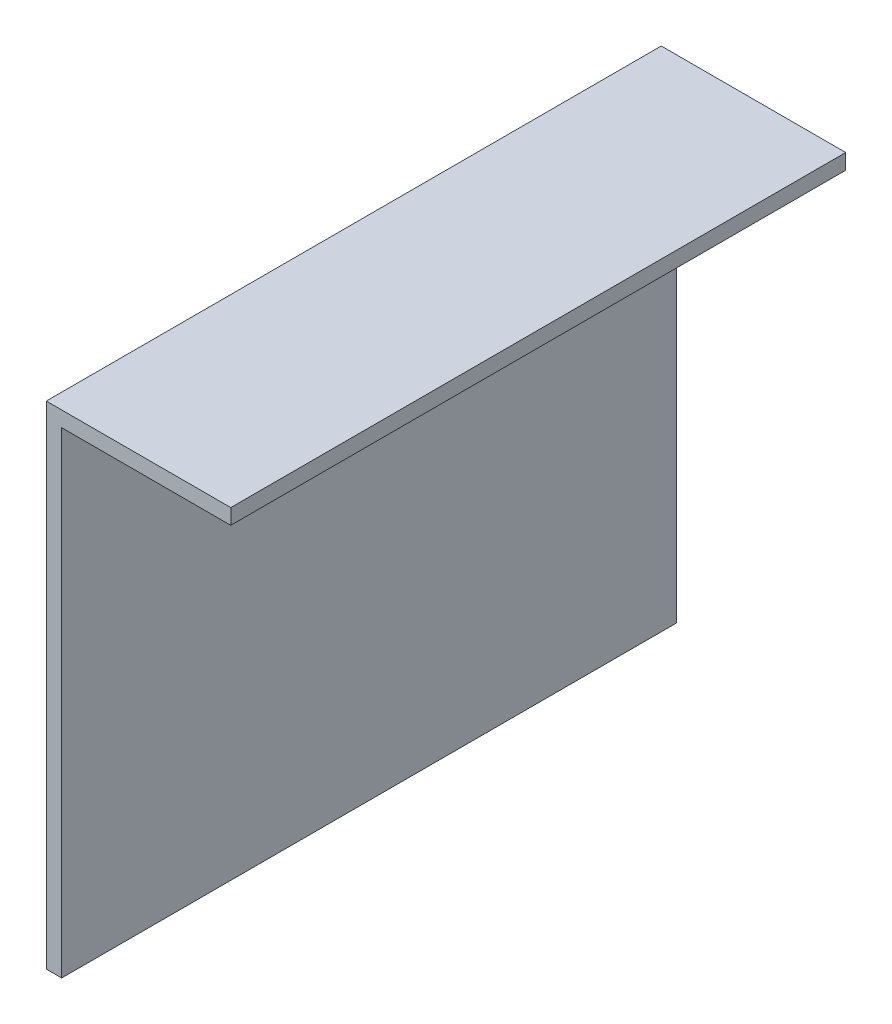
from build123d import *

# Parameters (mm, degrees)
BOSS_EXTRUDE1_DEPTH = 127


with BuildPart() as part:
    # Sketch1 → Boss-Extrude1 (new body)
    with BuildSketch(Plane.XY):
        Polygon((1.5875, 47.625), (36.5125, 47.625), (36.5125, 50.8), (-1.5875, 50.8), (-1.5875, -50.8), (1.5875, -50.8), align=None)
    extrude(amount=BOSS_EXTRUDE1_DEPTH)


solid = part.part
